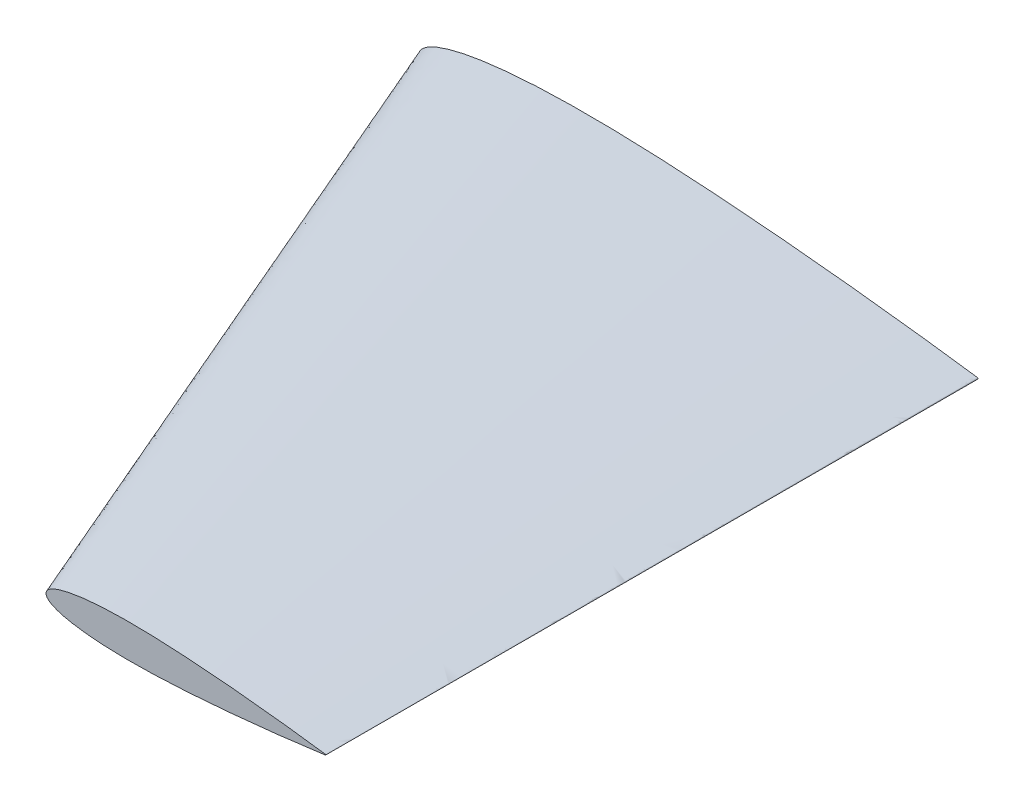
from build123d import *

# Parameters (mm, degrees)
SKETCH5_R          = 3.175
CUT_EXTRUDE1_DEPTH = 40


with BuildPart() as part:
    # Sketch3 for Loft1 → Loft1 section 0
    with BuildSketch(Plane(origin=(0, 0, 0), x_dir=(0, 1, 0), z_dir=(0, 0, 1))):
        with BuildLine():
            # circular arc as an exact rational Bezier (weights 1, cos(half-angle), 1)
            Bezier((-0.1512, -120), (0, -121.078173576), (0.1512, -120), weights=[1, 0.138878188, 1])
            add(Edge.make_bspline(
                [(0.1512, -120), (0.159844137, -119.938360579), (0.194373596, -119.692138686), (0.271412423, -119.139560673), (0.398715, -118.222411649), (0.573372813, -116.946295832), (0.793379557, -115.319142573), (1.054290593, -113.350899215), (1.352596715, -111.053721994), (1.683606416, -108.441806165), (2.042875491, -105.531225851), (2.425107573, -102.339929513), (2.825697229, -98.887613738), (3.239149275, -95.195513396), (3.660428144, -91.286411805), (4.084297863, -87.184435352), (4.505288371, -82.914864736), (4.917489923, -78.50403474), (5.315491249, -73.979109218), (5.692638455, -69.368035292), (6.042782149, -64.699145998), (6.35942163, -60.001269009), (6.635936242, -55.303349817), (6.86534019, -50.634309882), (7.041516205, -46.022985046), (7.158716765, -41.497672629), (7.21121735, -37.086338139), (7.194851491, -32.816087401), (7.10645799, -28.713247623), (6.94379617, -24.803073659), (6.706440531, -21.109633378), (6.395105262, -17.655626798), (6.012221903, -14.462189981), (5.561048227, -11.548787947), (5.046296355, -8.933075209), (4.473786726, -6.630382819), (3.849102022, -4.653795673), (3.178060312, -3.013356131), (2.465201511, -1.714295601), (1.709118655, -0.758613028), (0.89152038, -0.146506115), (0, 0.068277058), (-0.89152038, -0.146506115), (-1.709118655, -0.758613028), (-2.465201511, -1.714295601), (-3.178060312, -3.013356131), (-3.849102022, -4.653795673), (-4.473786726, -6.630382819), (-5.046296355, -8.933075209), (-5.561048227, -11.548787947), (-6.012221903, -14.462189981), (-6.395105262, -17.655626798), (-6.706440531, -21.109633378), (-6.94379617, -24.803073659), (-7.10645799, -28.713247623), (-7.194851491, -32.816087401), (-7.21121735, -37.086338139), (-7.158716765, -41.497672629), (-7.041516205, -46.022985046), (-6.86534019, -50.634309882), (-6.635936242, -55.303349817), (-6.35942163, -60.001269009), (-6.042782149, -64.699145998), (-5.692638455, -69.368035292), (-5.315491249, -73.979109218), (-4.917489923, -78.50403474), (-4.505288371, -82.914864736), (-4.084297863, -87.184435352), (-3.660428144, -91.286411805), (-3.239149275, -95.195513396), (-2.825697229, -98.887613738), (-2.425107573, -102.339929513), (-2.042875491, -105.531225851), (-1.683606416, -108.441806165), (-1.352596715, -111.053721994), (-1.054290593, -113.350899215), (-0.793379557, -115.319142573), (-0.573372813, -116.946295832), (-0.398715, -118.222411649), (-0.271412423, -119.139560673), (-0.194373596, -119.692138686), (-0.159844137, -119.938360579), (-0.1512, -120)],
                knots=[0, 0, 0, 0, 0.000763157, 0.003048469, 0.00684069, 0.012116132, 0.018840792, 0.02697275, 0.036459854, 0.047242945, 0.059253555, 0.072417264, 0.086651022, 0.101866322, 0.117968955, 0.134857919, 0.152428309, 0.170571841, 0.189174522, 0.208122338, 0.227296649, 0.24658007, 0.265853108, 0.284996761, 0.303895242, 0.322432581, 0.340498659, 0.357984483, 0.374788114, 0.390812303, 0.405965006, 0.420162443, 0.433328265, 0.445393603, 0.456301171, 0.466003881, 0.474472001, 0.481696232, 0.487703698, 0.492583405, 0.496543603, 0.5, 0.503456397, 0.507416595, 0.512296302, 0.518303768, 0.525527999, 0.533996119, 0.543698829, 0.554606397, 0.566671735, 0.579837557, 0.594034994, 0.609187697, 0.625211886, 0.642015517, 0.659501341, 0.677567419, 0.696104758, 0.715003239, 0.734146892, 0.75341993, 0.772703351, 0.791877662, 0.810825478, 0.829428159, 0.847571691, 0.865142081, 0.882031045, 0.898133678, 0.913348978, 0.927582736, 0.940746445, 0.952757055, 0.963540146, 0.97302725, 0.981159208, 0.987883868, 0.99315931, 0.996951531, 0.999236843, 1, 1, 1, 1], degree=3))
        make_face()
    # Sketch4 for Loft1 → Loft1 section 1
    with BuildSketch(Plane(origin=(0, 0, 140), x_dir=(0, 1, 0), z_dir=(0, 0, 1))):
        with BuildLine():
            Bezier((-0.075640055, -119.989438633), (-4.0055e-05, -120.528330492), (0.075559945, -119.989438633), weights=[1, 0.138927454, 1])
            add(Edge.make_bspline(
                [(0.075559945, -119.989438633), (0.077198221, -119.977760672), (0.083747244, -119.931077937), (0.098437827, -119.826143973), (0.122831359, -119.651527751), (0.195146681, -119.131424143), (0.2819676, -118.498134897), (0.382414106, -117.753099221), (0.459574184, -117.174553349), (0.544150807, -116.532515346), (0.635689659, -115.828486368), (0.733628286, -115.064106074), (0.837464463, -114.241163568), (1.075161055, -112.325731132), (1.313876421, -110.307188391), (1.552035688, -108.190297203), (1.726640199, -106.601951775), (1.900329487, -104.962253803), (2.117471633, -102.827693951), (2.334569826, -100.595297881), (2.541042931, -98.320908545), (2.740886394, -95.980256375), (2.892283955, -94.077542822), (3.03216992, -92.161031449), (3.130930911, -90.714028229), (3.22243112, -89.265329964), (3.305892513, -87.818319893), (3.380539712, -86.376376939), (3.445620697, -84.942866454), (3.500396785, -83.521135189), (3.544163261, -82.114504022), (3.576280879, -80.726258367), (3.596139117, -79.359636832), (3.603199898, -78.017830435), (3.597001484, -76.703972191), (3.577173227, -75.421130744), (3.543408178, -74.17229907), (3.495521833, -72.960391585), (3.433424671, -71.788237794), (3.357102818, -70.658574525), (3.266684416, -69.574033452), (3.162378616, -68.537141675), (3.044475648, -67.550317016), (2.913396661, -66.615852878), (2.769584171, -65.73592277), (2.613628381, -64.912557535), (2.446096721, -64.147660562), (2.26767741, -63.442972472), (2.079018161, -62.800092864), (1.880829749, -62.220436603), (1.673776147, -61.705240891), (1.458473652, -61.255527813), (1.235410311, -60.87209472), (1.004839564, -60.555502771), (0.766541112, -60.306212939), (0.519677952, -60.125031818), (0.263178636, -60.014158795), (-4.0055e-05, -59.977388239), (-0.263258746, -60.014158795), (-0.519758063, -60.125031818), (-0.766621223, -60.306212939), (-1.004919675, -60.555502771), (-1.235490421, -60.87209472), (-1.458553763, -61.255527813), (-1.673856257, -61.705240891), (-1.88090986, -62.220436603), (-2.079098271, -62.800092864), (-2.267757521, -63.442972472), (-2.446176832, -64.147660562), (-2.613708492, -64.912557535), (-2.769664281, -65.73592277), (-2.913476771, -66.615852878), (-3.044555758, -67.550317016), (-3.162458726, -68.537141675), (-3.266764526, -69.574033452), (-3.357182928, -70.658574525), (-3.433504781, -71.788237794), (-3.495601943, -72.960391585), (-3.543488288, -74.17229907), (-3.577253337, -75.421130744), (-3.597081594, -76.703972191), (-3.603280008, -78.017830435), (-3.596219228, -79.359636832), (-3.576360989, -80.726258367), (-3.544243371, -82.114504022), (-3.500476896, -83.521135189), (-3.445700807, -84.942866454), (-3.380619822, -86.376376939), (-3.305972623, -87.818319893), (-3.22251123, -89.265329964), (-3.131011021, -90.714028229), (-3.032250031, -92.161031449), (-2.892364065, -94.077542822), (-2.740966504, -95.980256375), (-2.541123041, -98.320908545), (-2.334647721, -100.595297762), (-2.077011343, -103.244570565), (-1.85686663, -105.378829109), (-1.680953364, -107.018285342), (-1.552115798, -108.190297203), (-1.313956531, -110.307188391), (-1.075241165, -112.325731132), (-0.837544573, -114.241163568), (-0.733708396, -115.064106074), (-0.635769769, -115.828486368), (-0.544230917, -116.532515346), (-0.459654295, -117.174553349), (-0.345628209, -118.02952035), (-0.244367617, -118.774446861), (-0.156822283, -119.407635639), (-0.12291147, -119.651527751), (-0.098517937, -119.826143973), (-0.083827354, -119.931077937), (-0.077278332, -119.977760672), (-0.075640055, -119.989438633)],
                knots=[0, 0, 0, 0, 0.000289146, 0.001155863, 0.002598059, 0.004612289, 0.014031413, 0.018271453, 0.023045738, 0.028342882, 0.034150137, 0.040453731, 0.047238593, 0.054488555, 0.087780092, 0.097077362, 0.106721847, 0.126960676, 0.137507311, 0.15933101, 0.181956676, 0.19350401, 0.216932159, 0.228757987, 0.24062146, 0.252494886, 0.264350491, 0.276160731, 0.287898257, 0.299535925, 0.311046959, 0.322405016, 0.333584241, 0.344559427, 0.355305877, 0.365799652, 0.376017633, 0.385937515, 0.395537821, 0.404798054, 0.413698797, 0.422221689, 0.430349461, 0.438066152, 0.445357166, 0.452209423, 0.458611485, 0.464554009, 0.470029938, 0.475035084, 0.479569179, 0.483636916, 0.487250222, 0.490431493, 0.493218847, 0.49567407, 0.497891229, 0.5, 0.502108771, 0.50432593, 0.506781153, 0.509568507, 0.512749778, 0.516363084, 0.520430821, 0.524964916, 0.529970062, 0.535445991, 0.541388515, 0.547790577, 0.554642834, 0.561933848, 0.569650539, 0.577778311, 0.586301203, 0.595201946, 0.604462179, 0.614062485, 0.623982367, 0.634200348, 0.644694123, 0.655440573, 0.666415759, 0.677594984, 0.688953041, 0.700464075, 0.712101743, 0.723839269, 0.735649509, 0.747505114, 0.75937854, 0.771242013, 0.783067841, 0.80649599, 0.818043324, 0.84066899, 0.862492689, 0.883309252, 0.893278153, 0.902922638, 0.912219908, 0.945511445, 0.952761407, 0.959546269, 0.965849863, 0.971657118, 0.976954262, 0.981728547, 0.992806407, 0.995387711, 0.997401941, 0.998844137, 0.999710854, 1, 1, 1, 1], degree=3))
        make_face()
    loft()

    # Sketch5 → Cut-Extrude1 (cut)
    with BuildSketch(Plane(origin=(0, 0, 0), x_dir=(1, 0, 0), z_dir=(0, 0, -1))):
        with Locations(Location((59.978796141, 0, 0), (0, 0, 180))):
            Circle(SKETCH5_R)
    extrude(amount=-CUT_EXTRUDE1_DEPTH, mode=Mode.SUBTRACT)


solid = part.part
